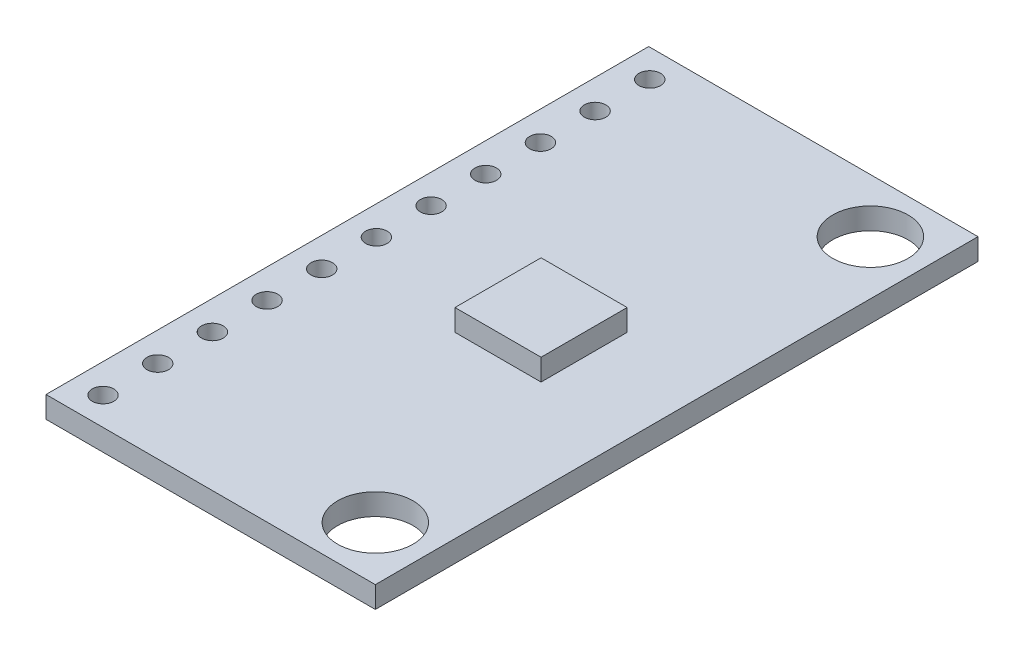
from build123d import *

# Parameters (mm, degrees)
SKETCH1_W           = 15.3
SKETCH1_H           = 28
SKETCH1_R           = 1.75
SKETCH1_R_2         = 0.5
BOSS_EXTRUDE1_DEPTH = 1
SKETCH2_W           = 4
SKETCH2_H           = 4
BOSS_EXTRUDE2_DEPTH = 1


with BuildPart() as part:
    # Sketch1 → Boss-Extrude1 (new body)
    with BuildSketch(Plane(origin=(0, 0, 0), x_dir=(1, 0, 0), z_dir=(0, 1, 0))):
        with Locations((-1.35, 0)):
            Rectangle(SKETCH1_W, SKETCH1_H)
        with Locations((3.8, 11.5)):
            Circle(SKETCH1_R, mode=Mode.SUBTRACT)
        with Locations((3.8, -11.5)):
            Circle(SKETCH1_R, mode=Mode.SUBTRACT)
        with Locations((-7.65, 0)):
            Circle(SKETCH1_R_2, mode=Mode.SUBTRACT)
        with Locations((-7.65, 2.54)):
            Circle(SKETCH1_R_2, mode=Mode.SUBTRACT)
        with Locations((-7.65, 5.08)):
            Circle(SKETCH1_R_2, mode=Mode.SUBTRACT)
        with Locations((-7.65, 7.62)):
            Circle(SKETCH1_R_2, mode=Mode.SUBTRACT)
        with Locations((-7.65, 10.16)):
            Circle(SKETCH1_R_2, mode=Mode.SUBTRACT)
        with Locations((-7.65, 12.7)):
            Circle(SKETCH1_R_2, mode=Mode.SUBTRACT)
        with Locations((-7.65, -12.7)):
            Circle(SKETCH1_R_2, mode=Mode.SUBTRACT)
        with Locations((-7.65, -10.16)):
            Circle(SKETCH1_R_2, mode=Mode.SUBTRACT)
        with Locations((-7.65, -7.62)):
            Circle(SKETCH1_R_2, mode=Mode.SUBTRACT)
        with Locations((-7.65, -5.08)):
            Circle(SKETCH1_R_2, mode=Mode.SUBTRACT)
        with Locations((-7.65, -2.54)):
            Circle(SKETCH1_R_2, mode=Mode.SUBTRACT)
    extrude(amount=BOSS_EXTRUDE1_DEPTH)

    # Sketch2 → Boss-Extrude2 (add)
    with BuildSketch(Plane(origin=(0, 1, 0), x_dir=(1, 0, 0), z_dir=(0, 1, 0))):
        Rectangle(SKETCH2_W, SKETCH2_H)
    extrude(amount=BOSS_EXTRUDE2_DEPTH)


solid = part.part
